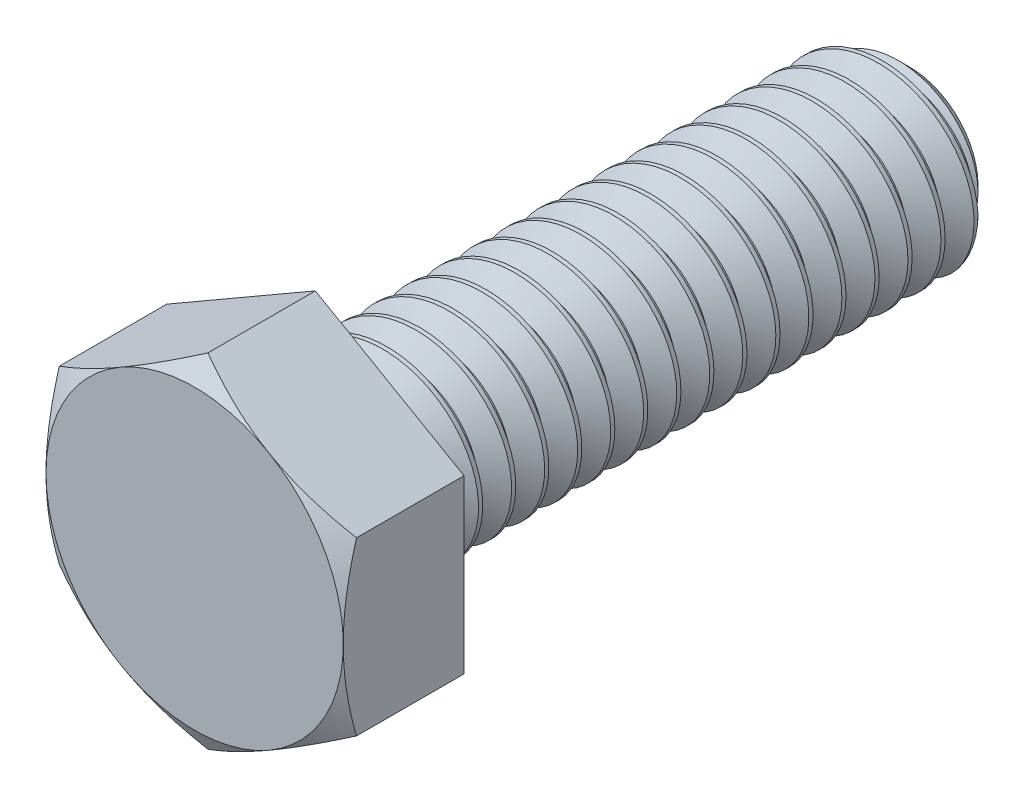
from build123d import *

# Parameters (mm, degrees)
SKETCH2_W           = 25.4
SKETCH2_H           = 3.96875
BOSS_EXTRUDE1_DEPTH = 5.159375
CHAMFER1_SIZE       = 1.058333333
SKETCH4_OUTSIDE_W   = 136.468
SKETCH4_OUTSIDE_H   = 138.432
SKETCH4_OUTSIDE_R   = 6.35
CUT_EXTRUDE1_DEPTH  = 33.061834535
CUT_EXTRUDE1_DRAFT  = -60
CUT_SWEEP1_PITCH    = 1.411111111
CUT_SWEEP1_TO       = 25.4


with BuildPart() as part:
    # Sketch2 → Revolve1 (revolve)
    with BuildSketch(Plane(origin=(0, 0, 0), x_dir=(0, 0, -1), z_dir=(1, 0, 0)), mode=Mode.PRIVATE) as revolve1_sk:
        with Locations((12.7, 1.984375)):
            Rectangle(SKETCH2_W, SKETCH2_H)
    revolve(revolve1_sk.sketch.rotate(Axis((0, 0, 0), (0, 0, -1)), 90), axis=Axis((0, 0, 0), (0, 0, -1)))

    # Sketch3 → Boss-Extrude1 (add)
    with BuildSketch(Plane.XY):
        Polygon((0, 7.332348419), (-6.35, 3.666174209), (-6.35, -3.666174209), (0, -7.332348419), (6.35, -3.666174209), (6.35, 3.666174209), align=None)
    extrude(amount=BOSS_EXTRUDE1_DEPTH)

    # Chamfer1
    chamfer1_edges = [part.edges().sort_by_distance(p)[0] for p in [
        (-3.96875, 0, -25.4),
    ]]
    chamfer(chamfer1_edges, length=CHAMFER1_SIZE)


with BuildPart() as cut_extrude1_tool:
    # Sketch4 outside → Cut-Extrude1 (with draft: the straight prism first)
    with BuildSketch(Plane.XY.offset(5.159375)):
        Rectangle(SKETCH4_OUTSIDE_W, SKETCH4_OUTSIDE_H)
        Circle(SKETCH4_OUTSIDE_R, mode=Mode.SUBTRACT)
    extrude(amount=-CUT_EXTRUDE1_DEPTH)
    # Cut-Extrude1: the draft: its side faces are tilted about the plane it starts from
    cut_extrude1_sides = [cut_extrude1_tool.faces().sort_by_distance(p)[0] for p in [
        (0, -69.216, -11.371542267),
        (68.234, 0, -11.371542267),
        (0, 69.216, -11.371542267),
        (-68.234, 0, -11.371542267),
        (-6.35, 0, -11.371542267),
    ]]
    draft(cut_extrude1_sides, Plane.XY.offset(5.159375), CUT_EXTRUDE1_DRAFT)


with BuildPart() as part_1:
    add(part.part)

    # Cut-Extrude1: cut by cut_extrude1_tool
    add(cut_extrude1_tool.part, mode=Mode.SUBTRACT)


with BuildPart() as body_2:
    # Split1: read off the stored shape, not the designer's step
    # Split1: the piece on the far side of the plane
    add(part_1.part)
    split(bisect_by=Plane.XY, keep=Keep.BOTTOM)

    # Cut-Sweep1: arcs per turn and ends read off the stored shape
    # Cut-Sweep1: the profile of Sketch5 screwed along a right-hand helix through 19 turns, 8 arcs to a turn; built about Z, then put on its axis
    cut_sweep1_z = Axis((0, 0, 0), (0, 0, 1))
    cut_sweep1_corners = [(4.045128629, 0, 0.044097222), (4.045128629, 0, -1.278819444), (3.052206448, 0, -0.705555556), (3.052206448, 0, -0.529166667)]
    with BuildLine(mode=Mode.PRIVATE) as cut_sweep1_profile:
        Line(cut_sweep1_corners[0], cut_sweep1_corners[1])
        Line(cut_sweep1_corners[1], cut_sweep1_corners[2])
        Line(cut_sweep1_corners[2], cut_sweep1_corners[3])
        Line(cut_sweep1_corners[3], cut_sweep1_corners[0])
    cut_sweep1_cap = Face(cut_sweep1_profile.wire())
    cut_sweep1_turn_angles = [0, 22.5, 45, 67.5, 90, 112.5, 135, 157.5, 180, 202.5, 225, 247.5, 270, 292.5, 315, 337.5, 360]
    cut_sweep1_turn_weights = [1, 0.9238795325112867, 1, 0.9238795325112867, 1, 0.9238795325112867, 1, 0.9238795325112867, 1, 0.9238795325112867, 1, 0.9238795325112867, 1, 0.9238795325112867, 1, 0.9238795325112867, 1]
    cut_sweep1_turn_rails = [Edge.make_bspline([Vector(p[0], p[1], 0).rotate(cut_sweep1_z, cut_sweep1_turn_angles[k]) / cut_sweep1_turn_weights[k] + Vector(0, 0, p[2] + CUT_SWEEP1_PITCH * cut_sweep1_turn_angles[k] / 360) for k in range(17)], [0, 0, 0, 1, 1, 2, 2, 3, 3, 4, 4, 5, 5, 6, 6, 7, 7, 8, 8, 8], 2, cut_sweep1_turn_weights) for p in cut_sweep1_corners]
    cut_sweep1_turn_sides = [Face.make_surface_from_curves(cut_sweep1_turn_rails[p[0]], cut_sweep1_turn_rails[p[1]]) for p in [(0, 1), (1, 2), (2, 3), (3, 0)]]
    cut_sweep1 = Plane(origin=(0, 0, -25.4), x_dir=(0, 1, 0), z_dir=(0, 0, 1)) * split(Solid(Shell([*[p.moved(Location((0, 0, CUT_SWEEP1_PITCH * i))) for i in range(19) for p in cut_sweep1_turn_sides], cut_sweep1_cap, cut_sweep1_cap.rotate(cut_sweep1_z, 6840).moved(Location((0, 0, CUT_SWEEP1_PITCH * 6840 / 360)))])), bisect_by=Plane.XY.offset(CUT_SWEEP1_TO), keep=Keep.BOTTOM, mode=Mode.PRIVATE)
    add(cut_sweep1, mode=Mode.SUBTRACT)


with BuildPart() as part_2:
    add(part_1.part)

    # Split1
    split(bisect_by=Plane.XY, keep=Keep.TOP)

    # Combine1: union body 2
    add(body_2.part)


solid = part_2.part
